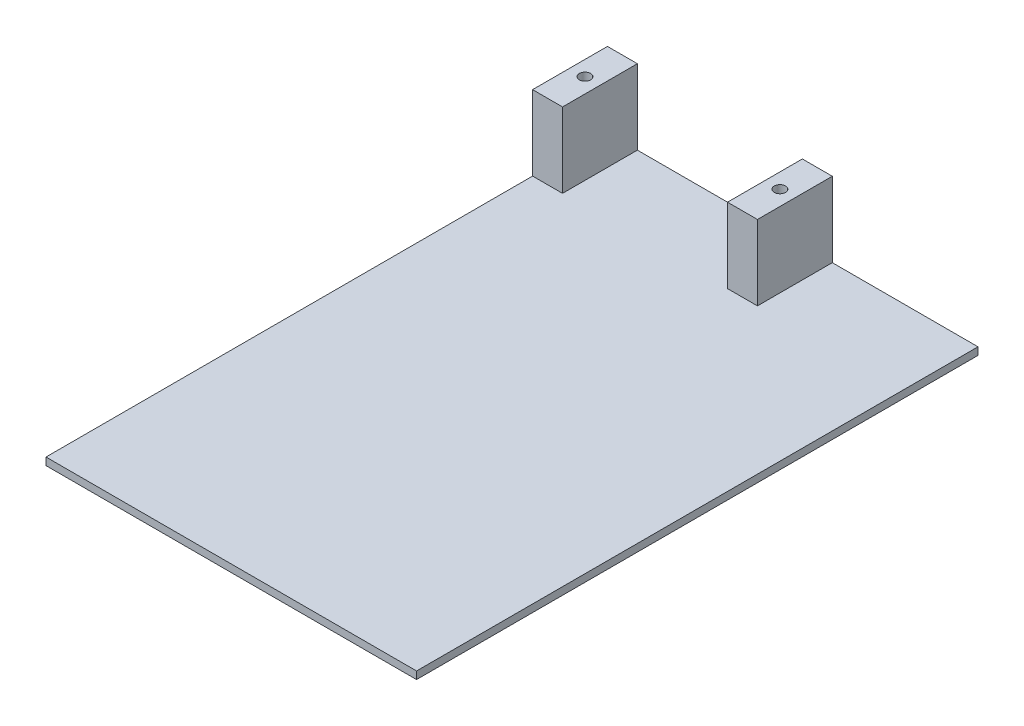
from build123d import *

# Parameters (mm, degrees)
SKETCH1_W           = 99
SKETCH1_H           = 150
BOSS_EXTRUDE1_DEPTH = 2
SKETCH2_W           = 8
SKETCH2_H           = 20
BOSS_EXTRUDE2_DEPTH = 20
SKETCH3_R           = 1.5
CUT_EXTRUDE2_DEPTH  = 15


with BuildPart() as part:
    # Sketch1 → Boss-Extrude1 (new body)
    with BuildSketch(Plane(origin=(0, 0, 0), x_dir=(1, 0, 0), z_dir=(0, 1, 0))):
        with Locations((49.5, 75)):
            Rectangle(SKETCH1_W, SKETCH1_H)
    extrude(amount=BOSS_EXTRUDE1_DEPTH)

    # Sketch2 → Boss-Extrude2 (add)
    with BuildSketch(Plane(origin=(0, 2, 0), x_dir=(1, 0, 0), z_dir=(0, 1, 0))):
        with Locations((4, 140)):
            Rectangle(SKETCH2_W, SKETCH2_H)
        with Locations((56.075, 140)):
            Rectangle(SKETCH2_W, SKETCH2_H)
    extrude(amount=BOSS_EXTRUDE2_DEPTH)

    # Sketch3 → Cut-Extrude2 (cut)
    with BuildSketch(Plane(origin=(0, 22, 0), x_dir=(1, 0, 0), z_dir=(0, 1, 0))):
        with Locations((4, 140)):
            Circle(SKETCH3_R)
        with Locations((56.075, 140)):
            Circle(SKETCH3_R)
    extrude(amount=-CUT_EXTRUDE2_DEPTH, mode=Mode.SUBTRACT)


solid = part.part
